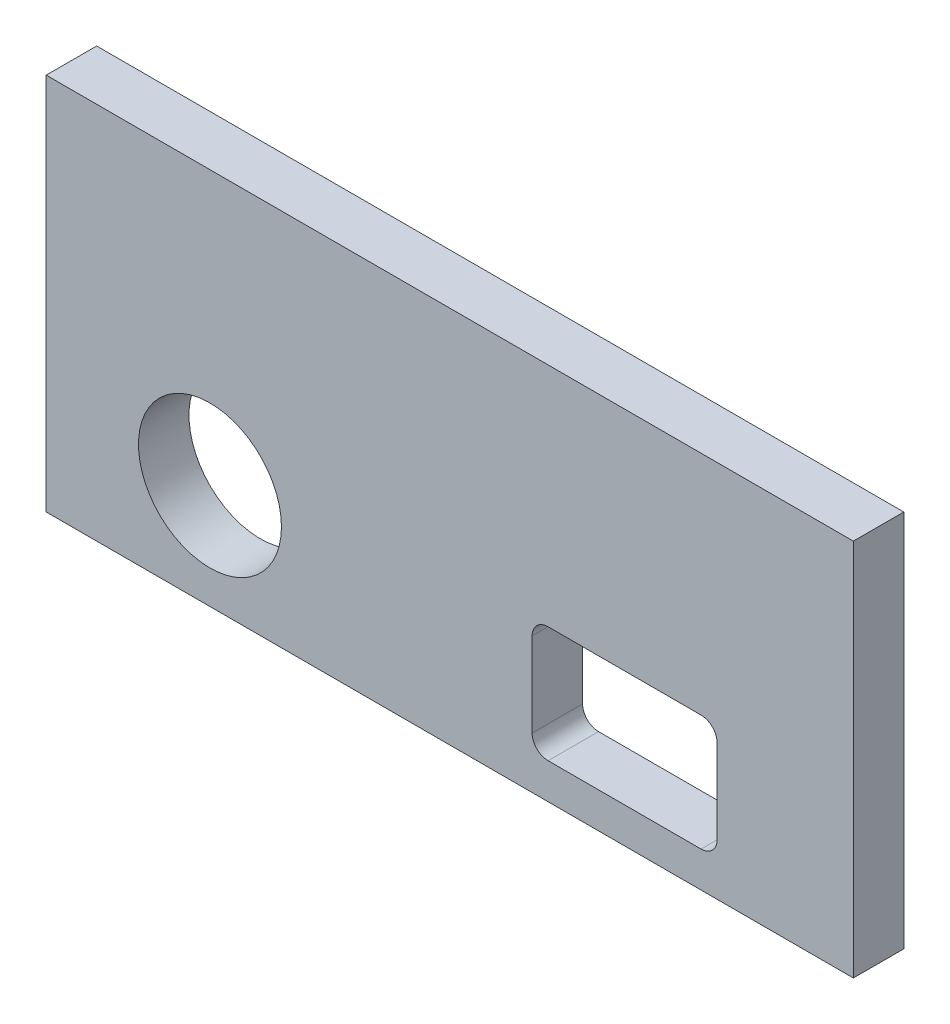
from build123d import *

# Parameters (mm, degrees)
BOSS_EXTRUDE1_START = 0.25
SKETCH1_W           = 48
SKETCH1_H           = 22.5
SKETCH1_R           = 4.25
BOSS_EXTRUDE1_DEPTH = 3


with BuildPart() as part:
    # Sketch1 → Boss-Extrude1 (new body)
    with BuildSketch(Plane.XY.offset(74.280531955).offset(BOSS_EXTRUDE1_START)):
        with Locations((32.921525611, 35.921825564)):
            Rectangle(SKETCH1_W, SKETCH1_H)
        with Locations((18.660828036, 30.906825564)):
            Circle(SKETCH1_R, mode=Mode.SUBTRACT)
        with BuildLine():
            Line((37.818598421, 32.735851952), (37.818598421, 27.735851952))
            ThreePointArc((37.818598421, 27.735851952), (38.096846979, 27.06410051), (38.768598421, 26.785851952))
            Line((38.768598421, 26.785851952), (47.868598421, 26.785851952))
            ThreePointArc((47.868598421, 26.785851952), (48.540349863, 27.06410051), (48.818598421, 27.735851952))
            Line((48.818598421, 27.735851952), (48.818598421, 32.735851952))
            ThreePointArc((48.818598421, 32.735851952), (48.540349863, 33.407603394), (47.868598421, 33.685851952))
            Line((47.868598421, 33.685851952), (38.768598421, 33.685851952))
            ThreePointArc((38.768598421, 33.685851952), (38.096846979, 33.407603394), (37.818598421, 32.735851952))
        make_face(mode=Mode.SUBTRACT)
    extrude(amount=BOSS_EXTRUDE1_DEPTH)


solid = part.part
